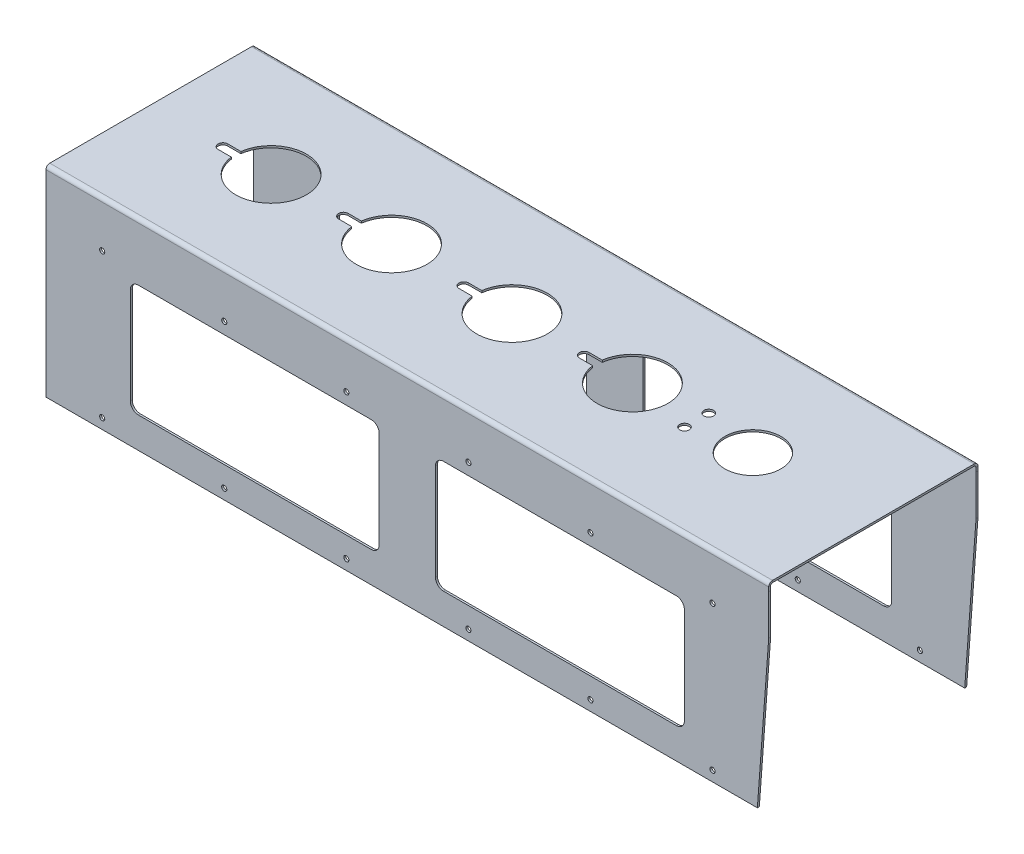
from build123d import *

# Parameters (mm, degrees)
SKETCH1_W               = 450
SKETCH1_H               = 125.6
BOSS_EXTRUDE1_DEPTH     = 1.22
EDGE_FLANGE1_DEPTH      = 450
EDGE_FLANGE1_BEND_DEPTH = 450
CUT_EXTRUDE1_DEPTH      = 265.939058972
CUT_EXTRUDE1_DEPTH_BACK = 265.939058972
CUT_EXTRUDE2_DEPTH      = 266.511236239
CUT_EXTRUDE2_DEPTH_BACK = 266.511236239
SKETCH13_R              = 17.5
SKETCH13_R_2            = 3
CUT_EXTRUDE3_DEPTH      = 265.939058972
CUT_EXTRUDE3_DEPTH_BACK = 265.939058972
CUT_EXTRUDE4_DEPTH      = 265.939058972
CUT_EXTRUDE4_DEPTH_BACK = 265.939058972
SKETCH17_R              = 1.6


# Sheet-metal steps are written as plain solids
with BuildPart() as part:
    # Sketch1 → Boss-Extrude1 (new body)
    with BuildSketch(Plane(origin=(0, 0, 0), x_dir=(1, 0, 0), z_dir=(0, 1, 0))):
        Rectangle(SKETCH1_W, SKETCH1_H)
    extrude(amount=BOSS_EXTRUDE1_DEPTH)

    # Edge-Flange1 section (across the edge) → Edge-Flange1 (add)
    with BuildSketch(Plane(origin=(225, 0, 63.943), x_dir=(0, 0, -1), z_dir=(-1, 0, 0))):
        with BuildLine():
            Line((-1.22, 1.143), (-1.22, 123.78))
            Line((-1.22, 123.78), (0, 123.78))
            Line((0, 123.78), (0, 1.143))
            ThreePointArc((0, 1.143), (0.334776949, 0.334776949), (1.143, 0))
            Line((1.143, 0), (1.143, -1.22))
            ThreePointArc((1.143, -1.22), (-0.527893324, -0.527893324), (-1.22, 1.143))
        make_face()
    extrude(amount=EDGE_FLANGE1_DEPTH)

    # Edge-Flange1 section 2 (across the edge) → Edge-Flange1 bend (add)
    with BuildSketch(Plane(origin=(-225, 0, -63.943), x_dir=(0, 0, 1), z_dir=(1, 0, 0))):
        with BuildLine():
            Line((-1.22, 1.143), (-1.22, 123.78))
            Line((-1.22, 123.78), (0, 123.78))
            Line((0, 123.78), (0, 1.143))
            ThreePointArc((0, 1.143), (0.334776949, 0.334776949), (1.143, 0))
            Line((1.143, 0), (1.143, -1.22))
            ThreePointArc((1.143, -1.22), (-0.527893324, -0.527893324), (-1.22, 1.143))
        make_face()
    extrude(amount=EDGE_FLANGE1_BEND_DEPTH)

    # Sketch12 → Cut-Extrude1 (cut, two sides: drawn at the far end of the back side and taken through both)
    with BuildSketch(Plane.XY.offset(-CUT_EXTRUDE1_DEPTH_BACK)):
        Polygon((225, -3.78), (225, -28.78), (210.508996835, -223.78), (210.508996835, -248.78), (235.508996835, -248.78), (235.508996835, -3.78), align=None)
    extrude(amount=CUT_EXTRUDE1_DEPTH + CUT_EXTRUDE1_DEPTH_BACK, mode=Mode.SUBTRACT)

    # Sketch13 → Cut-Extrude2 (cut, two sides: drawn at the far end of the back side and taken through both)
    with BuildSketch(Plane(origin=(0, 1.22, 0), x_dir=(1, 0, 0), z_dir=(0, 1, 0)).offset(-CUT_EXTRUDE2_DEPTH_BACK)):
        with Locations(Location((150, 0, 0), (0, 0, 270))):
            Circle(SKETCH13_R)
        with Locations(Location((114.948, 7.564, 0), (0, 0, 270))):
            Circle(SKETCH13_R_2)
        with Locations(Location((114.947, -7.548, 0), (0, 0, 270))):
            Circle(SKETCH13_R_2)
        with BuildLine():
            Line((45, 3), (53.205505282, 3))
            ThreePointArc((53.205505282, 3), (97, 0), (53.205505282, -3))
            Line((53.205505282, -3), (45, -3))
            ThreePointArc((45, -3), (42, 0), (45, 3))
        make_face()
        with BuildLine():
            Line((-30, 3), (-21.794494718, 3))
            ThreePointArc((-21.794494718, 3), (22, 0), (-21.794494718, -3))
            Line((-21.794494718, -3), (-30, -3))
            ThreePointArc((-30, -3), (-33, 0), (-30, 3))
        make_face()
        with BuildLine():
            Line((-105, 3), (-96.794494718, 3))
            ThreePointArc((-96.794494718, 3), (-53, 0), (-96.794494718, -3))
            Line((-96.794494718, -3), (-105, -3))
            ThreePointArc((-105, -3), (-108, 0), (-105, 3))
        make_face()
        with BuildLine():
            Line((-180, 3), (-171.794494718, 3))
            ThreePointArc((-171.794494718, 3), (-128, 0), (-171.794494718, -3))
            Line((-171.794494718, -3), (-180, -3))
            ThreePointArc((-180, -3), (-183, 0), (-180, 3))
        make_face()
    extrude(amount=CUT_EXTRUDE2_DEPTH + CUT_EXTRUDE2_DEPTH_BACK, mode=Mode.SUBTRACT)

    # Sketch16 → Cut-Extrude3 (cut, two sides: drawn at the far end of the back side and taken through both)
    with BuildSketch(Plane.XY.offset(-CUT_EXTRUDE3_DEPTH_BACK)):
        with BuildLine():
            Line((-22.5, -104.646), (-167.5, -104.646))
            ThreePointArc((-167.5, -104.646), (-171.035533906, -103.181533906), (-172.5, -99.646))
            Line((-172.5, -99.646), (-172.5, -39.646))
            ThreePointArc((-172.5, -39.646), (-171.035533906, -36.110466094), (-167.5, -34.646))
            Line((-167.5, -34.646), (-22.5, -34.646))
            ThreePointArc((-22.5, -34.646), (-18.964466094, -36.110466094), (-17.5, -39.646))
            Line((-17.5, -39.646), (-17.5, -99.646))
            ThreePointArc((-17.5, -99.646), (-18.964466094, -103.181533906), (-22.5, -104.646))
        make_face()
        with BuildLine():
            Line((172.5, -99.646), (172.5, -39.646))
            ThreePointArc((172.5, -39.646), (171.035533906, -36.110466094), (167.5, -34.646))
            Line((167.5, -34.646), (22.5, -34.646))
            ThreePointArc((22.5, -34.646), (18.964466094, -36.110466094), (17.5, -39.646))
            Line((17.5, -39.646), (17.5, -99.646))
            ThreePointArc((17.5, -99.646), (18.964466094, -103.181533906), (22.5, -104.646))
            Line((22.5, -104.646), (167.5, -104.646))
            ThreePointArc((167.5, -104.646), (171.035533906, -103.181533906), (172.5, -99.646))
        make_face()
    extrude(amount=CUT_EXTRUDE3_DEPTH + CUT_EXTRUDE3_DEPTH_BACK, mode=Mode.SUBTRACT)

    # Sketch17 → Cut-Extrude4 (cut, two sides: drawn at the far end of the back side and taken through both)
    with BuildSketch(Plane.XY.offset(-CUT_EXTRUDE4_DEPTH_BACK)):
        with Locations((-190, -27.4)):
            Circle(SKETCH17_R)
        with Locations((-114, -27.4)):
            Circle(SKETCH17_R)
        with Locations((-38, -27.4)):
            Circle(SKETCH17_R)
        with Locations((38, -27.4)):
            Circle(SKETCH17_R)
        with Locations((114, -27.4)):
            Circle(SKETCH17_R)
        with Locations((190, -27.4)):
            Circle(SKETCH17_R)
        with Locations((190, -117.4)):
            Circle(SKETCH17_R)
        with Locations((114, -117.4)):
            Circle(SKETCH17_R)
        with Locations((38, -117.4)):
            Circle(SKETCH17_R)
        with Locations((-38, -117.4)):
            Circle(SKETCH17_R)
        with Locations((-114, -117.4)):
            Circle(SKETCH17_R)
        with Locations((-190, -117.4)):
            Circle(SKETCH17_R)
    extrude(amount=CUT_EXTRUDE4_DEPTH + CUT_EXTRUDE4_DEPTH_BACK, mode=Mode.SUBTRACT)


solid = part.part
